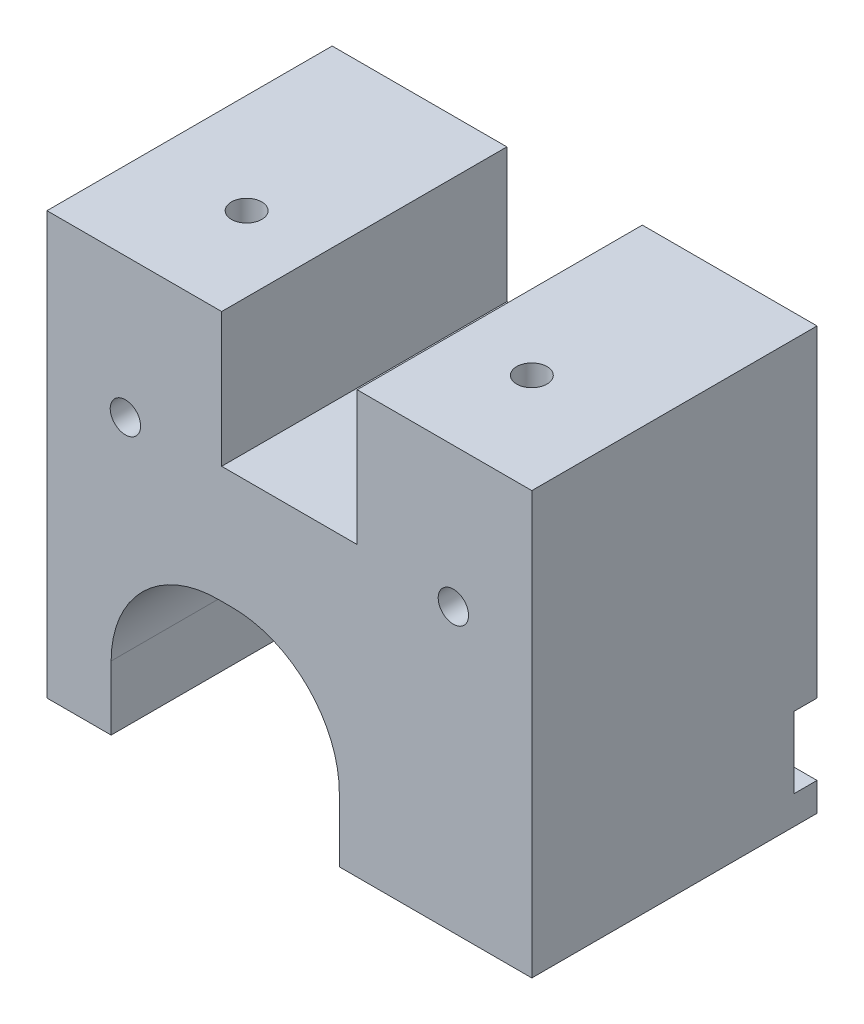
from build123d import *

# Parameters (mm, degrees)
SKETCH1_W                 = 43.18
SKETCH1_H                 = 25.4
BASE_DEPTH                = 37.592
SKETCH2_W                 = 12.065
SKETCH2_H                 = 11.938
LINACTSLOT_DEPTH          = 51.24387091
MOUTINGHOLES_D            = 2.7051
MOUTINGHOLES_DEPTH        = 14.478
MOUTINGHOLES_TIP          = 0.81269403
MOTORSLOT_DEPTH           = 51.24387091
MOTORMOUNTINGHOLES2_D     = 2.2606
MOTORMOUNTINGHOLES2_DEPTH = 11.43
MOTORMOUNTINGHOLES2_TIP   = 0.679152758
F_6_32_TAPPED_HOLE1_D     = 2.7051
F_6_32_TAPPED_HOLE1_DEPTH = 7.62
F_6_32_TAPPED_HOLE1_TIP   = 0.81269403
CUT_EXTRUDE1_DEPTH        = 2.032


with BuildPart() as part:
    # Sketch1 → Base (new body)
    with BuildSketch(Plane(origin=(0, 0, 0), x_dir=(1, 0, 0), z_dir=(0, 1, 0))):
        Rectangle(SKETCH1_W, SKETCH1_H)
    extrude(amount=BASE_DEPTH)

    # Sketch2 → LinActSlot (cut, through all)
    with BuildSketch(Plane.XY.offset(12.7)):
        with Locations((0, 31.623)):
            Rectangle(SKETCH2_W, SKETCH2_H)
    extrude(amount=-LINACTSLOT_DEPTH, mode=Mode.SUBTRACT)

    # MoutingHoles
    with Locations(Plane(origin=(14.160350453, 37.592, 8.373414988), x_dir=(-1, 0, 0), z_dir=(0, 1, 0))):
        with Locations((1.460350453, -4.563414988), (26.860350453, -4.563414988)):
            Hole(MOUTINGHOLES_D / 2, depth=MOUTINGHOLES_DEPTH)
            with Locations((0, 0, -(MOUTINGHOLES_DEPTH + MOUTINGHOLES_TIP / 2))):  # 118° drill point
                Cone(0, MOUTINGHOLES_D / 2, MOUTINGHOLES_TIP, mode=Mode.SUBTRACT)

    # Sketch11 → MotorSlot (cut, through all)
    with BuildSketch(Plane(origin=(0, 0, -12.7), x_dir=(-1, 0, 0), z_dir=(0, 0, -1))):
        with BuildLine():
            Line((15.875, 5.08), (15.875, 5.715))
            ThreePointArc((15.875, 5.715), (13.085192091, 12.450192091), (6.35, 15.24))
            Line((6.35, 15.24), (5.08, 15.24))
            ThreePointArc((5.08, 15.24), (-1.655192091, 12.450192091), (-4.445, 5.715))
            Line((-4.445, 5.715), (-4.445, 5.08))
            Line((-4.445, 5.08), (-4.445, 0))
            Line((-4.445, 0), (15.875, 0))
            Line((15.875, 0), (15.875, 5.08))
        make_face()
    extrude(amount=-MOTORSLOT_DEPTH, mode=Mode.SUBTRACT)

    # MotorMountingHoles2
    with Locations(Plane(origin=(0, 0, -12.7), x_dir=(-1, 0, 0), z_dir=(0, 0, -1))):
        with Locations((18.215, 5.715), (-6.785, 5.715)):
            Hole(MOTORMOUNTINGHOLES2_D / 2, depth=MOTORMOUNTINGHOLES2_DEPTH)
            with Locations((0, 0, -(MOTORMOUNTINGHOLES2_DEPTH + MOTORMOUNTINGHOLES2_TIP / 2))):  # 118° drill point
                Cone(0, MOTORMOUNTINGHOLES2_D / 2, MOTORMOUNTINGHOLES2_TIP, mode=Mode.SUBTRACT)

    # #6-32 Tapped Hole1
    with Locations(Plane.XY.offset(12.7)):
        with Locations((-14.605, 25.146), (14.605, 25.146)):
            Hole(F_6_32_TAPPED_HOLE1_D / 2, depth=F_6_32_TAPPED_HOLE1_DEPTH)
            with Locations((0, 0, -(F_6_32_TAPPED_HOLE1_DEPTH + F_6_32_TAPPED_HOLE1_TIP / 2))):  # 118° drill point
                Cone(0, F_6_32_TAPPED_HOLE1_D / 2, F_6_32_TAPPED_HOLE1_TIP, mode=Mode.SUBTRACT)

    # Sketch23 → Cut-Extrude1 (cut)
    with BuildSketch(Plane(origin=(0, 0, -12.7), x_dir=(-1, 0, 0), z_dir=(0, 0, -1))):
        with BuildLine():
            Line((21.59, 2.54), (-21.59, 2.54))
            ThreePointArc((-21.59, 2.54), (-24.765, 5.715), (-21.59, 8.89))
            Line((-21.59, 8.89), (21.59, 8.89))
            ThreePointArc((21.59, 8.89), (24.765, 5.715), (21.59, 2.54))
        make_face()
    extrude(amount=-CUT_EXTRUDE1_DEPTH, mode=Mode.SUBTRACT)


solid = part.part
